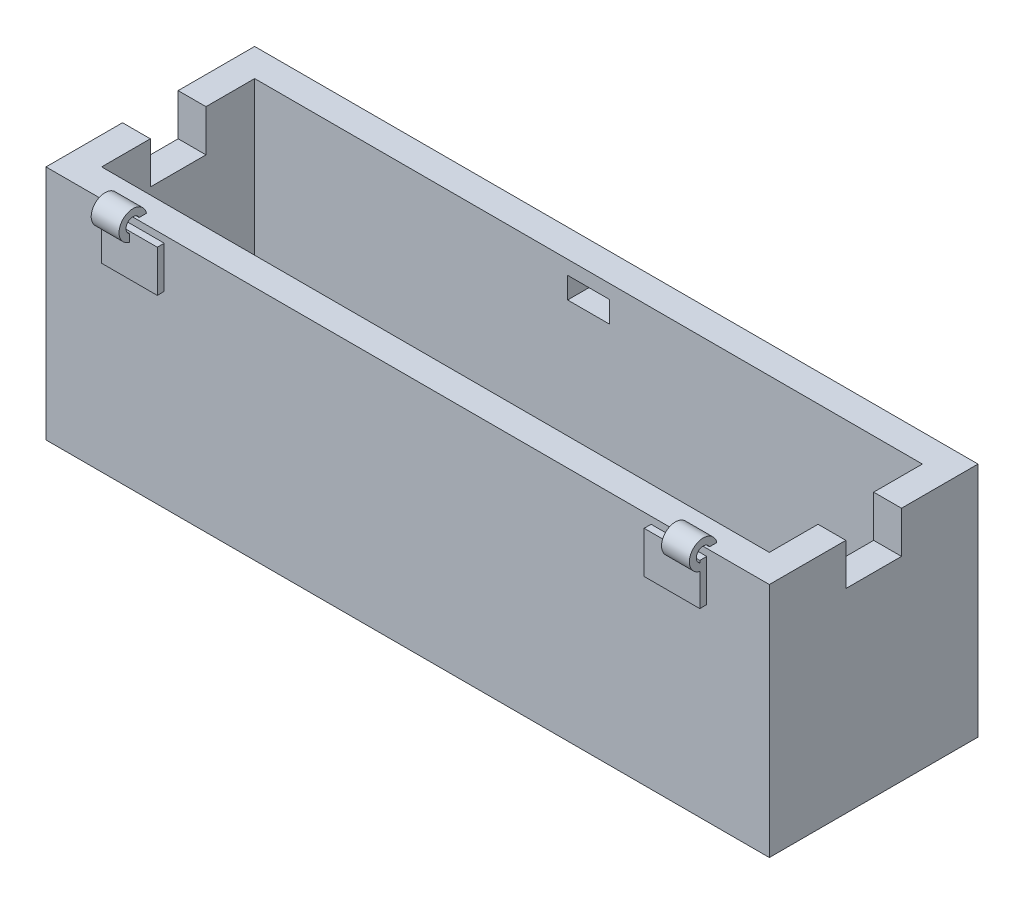
from build123d import *

# Parameters (mm, degrees)
SKETCH_1_W          = 520
SKETCH_1_H          = 150
EXTRUDE_1_DEPTH     = 140
SKETCH_2_W          = 480
SKETCH_2_H          = 110
CUT_EXTRUDE_1_DEPTH = 120
SKETCH_4_W          = 40
SKETCH_4_H          = 30
EXTRUDE_2_DEPTH     = 30
SKETCH_5_W          = 40
SKETCH_5_H          = 30
EXTRUDE_3_DEPTH     = 30
SKETCH_7_R          = 10
SKETCH_7_R_2        = 5
EXTRUDE_1_2_DEPTH   = 20
EXTRUDE_START       = -20
SKETCH_9_R          = 10
SKETCH_9_R_2        = 5
EXTRUDE_2_2_DEPTH   = 20
SKETCH_11_W         = 40
SKETCH_11_H         = 30
CUT_EXTRUDE_3_DEPTH = 548.622704745
SKETCH_13_W         = 520
SKETCH_13_H         = 150
EXTRUDE_6_DEPTH     = 30
SKETCH_14_W         = 40
SKETCH_14_H         = 5
CUT_EXTRUDE_6_DEPTH = 30
SKETCH_15_W         = 40
SKETCH_15_H         = 5
CUT_EXTRUDE_7_DEPTH = 30
SKETCH_18_W         = 30
SKETCH_18_H         = 15.352958973
CUT_EXTRUDE_8_DEPTH = 30
FILLET_1_R          = 10


with BuildPart() as part:
    # 草圖1 → Extrude 1 (new body)
    with BuildSketch(Plane(origin=(0, 0, 0), x_dir=(1, 0, 0), z_dir=(0, 1, 0))):
        Rectangle(SKETCH_1_W, SKETCH_1_H)
    extrude(amount=EXTRUDE_1_DEPTH)

    # 草圖2 → 除料-伸長1 (cut)
    with BuildSketch(Plane(origin=(0, 140, 0), x_dir=(1, 0, 0), z_dir=(0, 1, 0))):
        Rectangle(SKETCH_2_W, SKETCH_2_H)
    extrude(amount=-CUT_EXTRUDE_1_DEPTH, mode=Mode.SUBTRACT)

    # 草圖4 → Extrude 2 (add)
    with BuildSketch(Plane.XY.offset(80)):
        with Locations((-195, 120)):
            Rectangle(SKETCH_4_W, SKETCH_4_H)
    extrude(amount=-EXTRUDE_2_DEPTH)

    # 草圖5 → 填料-伸長3 (add)
    with BuildSketch(Plane.XY.offset(80)):
        with Locations((195, 120)):
            Rectangle(SKETCH_5_W, SKETCH_5_H)
    extrude(amount=-EXTRUDE_3_DEPTH)

    # 草圖7 → Extrude 1 2 (add)
    with BuildSketch(Plane(origin=(215, 0, 0), x_dir=(0, 0, -1), z_dir=(1, 0, 0))):
        with Locations((-77.5, 137.764599119)):
            Circle(SKETCH_7_R)
        with Locations((-77.5, 137.764599119)):
            Circle(SKETCH_7_R_2, mode=Mode.SUBTRACT)
    extrude(amount=-EXTRUDE_1_2_DEPTH)

    # 草圖9 → Extrude 2 2 (add)
    with BuildSketch(Plane.ZY.offset(215).offset(EXTRUDE_START)):
        with Locations((77.5, 137.764599119)):
            Circle(SKETCH_9_R)
        with Locations((77.5, 137.764599119)):
            Circle(SKETCH_9_R_2, mode=Mode.SUBTRACT)
    extrude(amount=EXTRUDE_2_2_DEPTH)

    # 草圖11 → 除料-伸長3 (cut, through all)
    with BuildSketch(Plane.ZY.offset(260)):
        with Locations((0, 125)):
            Rectangle(SKETCH_11_W, SKETCH_11_H)
    extrude(amount=-CUT_EXTRUDE_3_DEPTH, mode=Mode.SUBTRACT)

    # 草圖13 → 填料-伸長6 (add)
    with BuildSketch(Plane.XZ):
        Rectangle(SKETCH_13_W, SKETCH_13_H)
    extrude(amount=EXTRUDE_6_DEPTH)

    # 草圖14 → 除料-伸長6 (cut)
    with BuildSketch(Plane(origin=(0, 135, 0), x_dir=(1, 0, 0), z_dir=(0, 1, 0))):
        with Locations((195, -52.5)):
            Rectangle(SKETCH_14_W, SKETCH_14_H)
    extrude(amount=-CUT_EXTRUDE_6_DEPTH, mode=Mode.SUBTRACT)

    # 草圖15 → 除料-伸長7 (cut)
    with BuildSketch(Plane(origin=(0, 135, 0), x_dir=(1, 0, 0), z_dir=(0, 1, 0))):
        with Locations((-195, -52.5)):
            Rectangle(SKETCH_15_W, SKETCH_15_H)
    extrude(amount=-CUT_EXTRUDE_7_DEPTH, mode=Mode.SUBTRACT)

    # 草圖18 → 除料-伸長8 (cut)
    with BuildSketch(Plane(origin=(0, 0, -75), x_dir=(-1, 0, 0), z_dir=(0, 0, -1))):
        with Locations((0, 122.323520514)):
            Rectangle(SKETCH_18_W, SKETCH_18_H)
    extrude(amount=-CUT_EXTRUDE_8_DEPTH, mode=Mode.SUBTRACT)

    # 圓角1
    fillet_1_edges = [part.edges().sort_by_distance(p)[0] for p in [
        (0, 130, -75),
    ]]
    fillet(fillet_1_edges, radius=FILLET_1_R - 0.0001)  # a hair under: the kernel refuses the full size


solid = part.part
